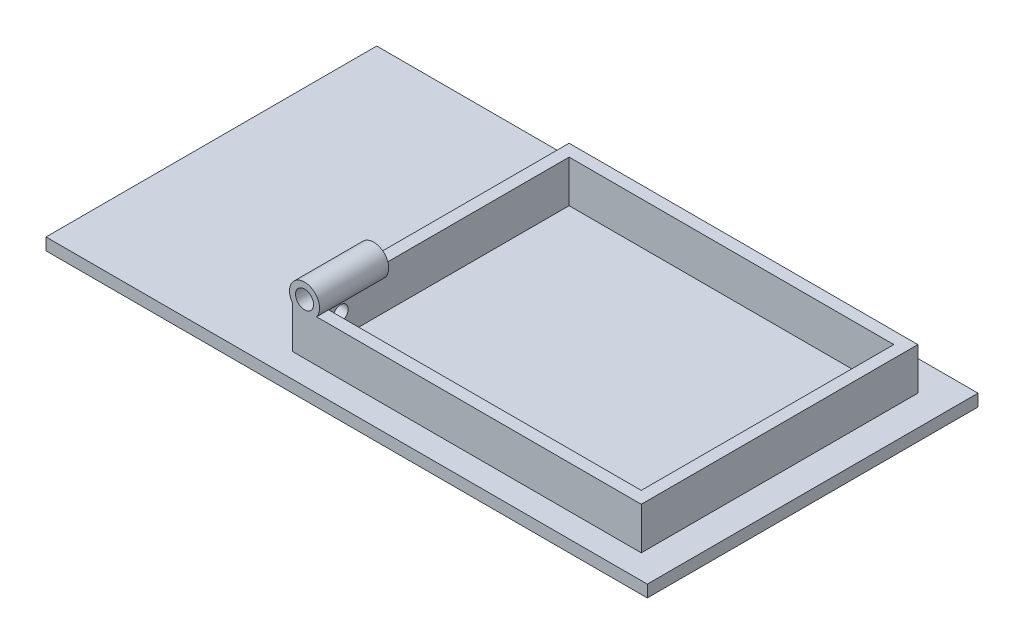
from build123d import *

# Parameters (mm, degrees)
SKETCH1_W            = 127
SKETCH1_H            = 69.85
CASE_BASE_DEPTH      = 2.54
SKETCH2_W            = 73.66
SKETCH2_H            = 58.42
SKETCH2_W_2          = 68.58
SKETCH2_H_2          = 53.34
PCB_HOLDER_DEPTH     = 8.89
SKETCH4_R            = 1.5875
WIRE_GAP_DEPTH       = 2.54
SKETCH16_R           = 3.175
SKETCH16_R_2         = 1.905
BOSS_EXTRUDE15_DEPTH = 14.605


with BuildPart() as part:
    # Sketch1 → Case-Base (new body)
    with BuildSketch(Plane(origin=(0, 0, 0), x_dir=(1, 0, 0), z_dir=(0, 1, 0))):
        Rectangle(SKETCH1_W, SKETCH1_H)
    extrude(amount=CASE_BASE_DEPTH)

    # Sketch2 → PCB-Holder (add)
    with BuildSketch(Plane(origin=(0, 2.54, 0), x_dir=(1, 0, 0), z_dir=(0, 1, 0))):
        with Locations((20.32, -0.635)):
            Rectangle(SKETCH2_W, SKETCH2_H)
        with Locations((20.32, -0.635)):
            Rectangle(SKETCH2_W_2, SKETCH2_H_2, mode=Mode.SUBTRACT)
    extrude(amount=PCB_HOLDER_DEPTH)

    # Sketch4 → Wire-Gap (cut)
    with BuildSketch(Plane.ZY.offset(16.51)):
        with Locations((22.225, 6.985)):
            Circle(SKETCH4_R)
    extrude(amount=-WIRE_GAP_DEPTH, mode=Mode.SUBTRACT)

    # Sketch16 → Boss-Extrude15 (add)
    with BuildSketch(Plane.XY.offset(29.845)):
        with Locations((-13.97, 13.335)):
            Circle(SKETCH16_R)
        with Locations((-13.97, 13.335)):
            Circle(SKETCH16_R_2, mode=Mode.SUBTRACT)
    extrude(amount=-BOSS_EXTRUDE15_DEPTH)


solid = part.part
